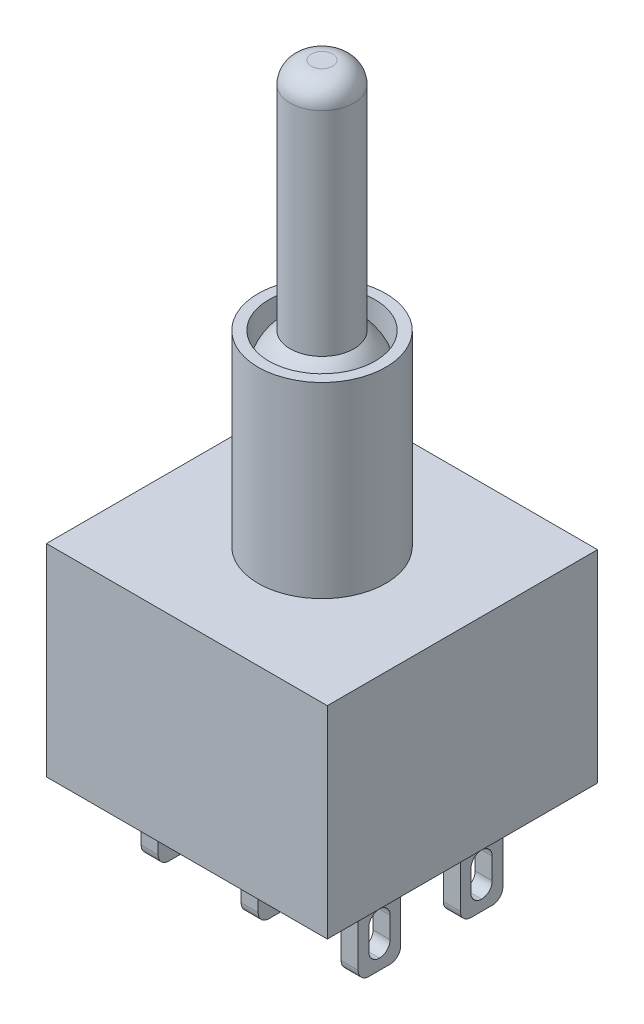
from build123d import *

# Parameters (mm, degrees)
SKETCH1_W           = 13.2
SKETCH1_H           = 12.7
BOSS_EXTRUDE1_DEPTH = 9.5
SKETCH2_R           = 3
BOSS_EXTRUDE2_DEPTH = 8.8
SKETCH4_R           = 2.5
CUT_EXTRUDE1_DEPTH  = 2
SKETCH5_R           = 1.5
BOSS_EXTRUDE3_DEPTH = 13
REVOLVE2_ANGLE      = 180
FILLET1_R           = 1
SKETCH6_W           = 0.8
SKETCH6_H           = 2
BOSS_EXTRUDE4_DEPTH = 4
SKETCH7_W           = 1
SKETCH7_H           = 2
CUT_EXTRUDE2_DEPTH  = 33.182332109
FILLET2_R           = 0.5


with BuildPart() as part:
    # Sketch1 → Boss-Extrude1 (new body)
    with BuildSketch(Plane(origin=(0, 0, 0), x_dir=(1, 0, 0), z_dir=(0, 1, 0))):
        Rectangle(SKETCH1_W, SKETCH1_H)
    extrude(amount=BOSS_EXTRUDE1_DEPTH)

    # Sketch2 → Boss-Extrude2 (add)
    with BuildSketch(Plane(origin=(0, 9.5, 0), x_dir=(1, 0, 0), z_dir=(0, 1, 0))):
        with Locations(Location((0, 0, 0), (0, 0, 270))):
            Circle(SKETCH2_R)
    extrude(amount=BOSS_EXTRUDE2_DEPTH)

    # Sketch4 → Cut-Extrude1 (cut)
    with BuildSketch(Plane(origin=(0, 18.3, 0), x_dir=(1, 0, 0), z_dir=(0, 1, 0))):
        with Locations(Location((0, 0, 0), (0, 0, 270))):
            Circle(SKETCH4_R)
    extrude(amount=-CUT_EXTRUDE1_DEPTH, mode=Mode.SUBTRACT)

    # Sketch5 → Boss-Extrude3 (add)
    with BuildSketch(Plane(origin=(0, 16.3, 0), x_dir=(1, 0, 0), z_dir=(0, 1, 0))):
        with Locations(Location((0, 0, 0), (0, 0, 90))):
            Circle(SKETCH5_R)
    extrude(amount=BOSS_EXTRUDE3_DEPTH)

    # Sketch3 → Revolve2 (revolve)
    with BuildSketch(Plane(origin=(0, 16.3, 0), x_dir=(1, 0, 0), z_dir=(0, 1, 0))):
        with BuildLine():
            Line((0, -2.5), (0, 2.5))
            ThreePointArc((0, 2.5), (-2.5, 0), (0, -2.5))
        make_face()
    revolve(axis=Axis((0, 16.3, 3), (0, 0, -1)), revolution_arc=REVOLVE2_ANGLE)

    # Fillet1
    fillet1_edges = [part.edges().sort_by_distance(p)[0] for p in [
        (0, 29.3, 1.5),
    ]]
    fillet(fillet1_edges, radius=FILLET1_R)

    # Sketch6 → Boss-Extrude4 (add)
    with BuildSketch(Plane.XZ):
        with Locations((-4.7, 2.4)):
            Rectangle(SKETCH6_W, SKETCH6_H)
        with Locations((-4.7, -2.4)):
            Rectangle(SKETCH6_W, SKETCH6_H)
        with Locations((0, -2.4)):
            Rectangle(SKETCH6_W, SKETCH6_H)
        with Locations((0, 2.4)):
            Rectangle(SKETCH6_W, SKETCH6_H)
        with Locations((4.7, 2.4)):
            Rectangle(SKETCH6_W, SKETCH6_H)
        with Locations((4.7, -2.4)):
            Rectangle(SKETCH6_W, SKETCH6_H)
    extrude(amount=BOSS_EXTRUDE4_DEPTH)

    # Sketch7 → Cut-Extrude2 (cut, through all)
    with BuildSketch(Plane.ZY.offset(5.1)):
        with Locations((-2.4, -2.5)):
            Rectangle(SKETCH7_W, SKETCH7_H)
        with Locations((2.4, -2.5)):
            Rectangle(SKETCH7_W, SKETCH7_H)
    extrude(amount=-CUT_EXTRUDE2_DEPTH, mode=Mode.SUBTRACT)

    # Fillet2
    fillet2_edges = [part.edges().sort_by_distance(p)[0] for p in [
        (4.7, -3.5, 2.9),
        (4.7, -3.5, 1.9),
        (4.7, -3.5, -1.9),
        (4.7, -3.5, -2.9),
        (4.7, -1.5, -1.9),
        (4.7, -1.5, 2.9),
        (4.7, -1.5, 1.9),
        (4.7, -1.5, -2.9),
        (0, -1.5, 1.9),
        (0, -1.5, 2.9),
        (0, -3.5, 2.9),
        (0, -3.5, 1.9),
        (0, -3.5, -1.9),
        (0, -3.5, -2.9),
        (0, -1.5, -2.9),
        (0, -1.5, -1.9),
        (-4.7, -3.5, 2.9),
        (-4.7, -1.5, 2.9),
        (-4.7, -3.5, 1.9),
        (-4.7, -1.5, 1.9),
        (-4.7, -1.5, -1.9),
        (-4.7, -1.5, -2.9),
        (-4.7, -3.5, -1.9),
        (-4.7, -3.5, -2.9),
        (0, -4, -1.4),
        (0, -4, -3.4),
        (4.7, -4, -1.4),
        (4.7, -4, -3.4),
        (4.7, -4, 1.4),
        (4.7, -4, 3.4),
        (0, -4, 3.4),
        (0, -4, 1.4),
        (-4.7, -4, 3.4),
        (-4.7, -4, 1.4),
        (-4.7, -4, -1.4),
        (-4.7, -4, -3.4),
    ]]
    fillet(fillet2_edges, radius=FILLET2_R - 0.0001)  # a hair under: the kernel refuses the full size


solid = part.part
